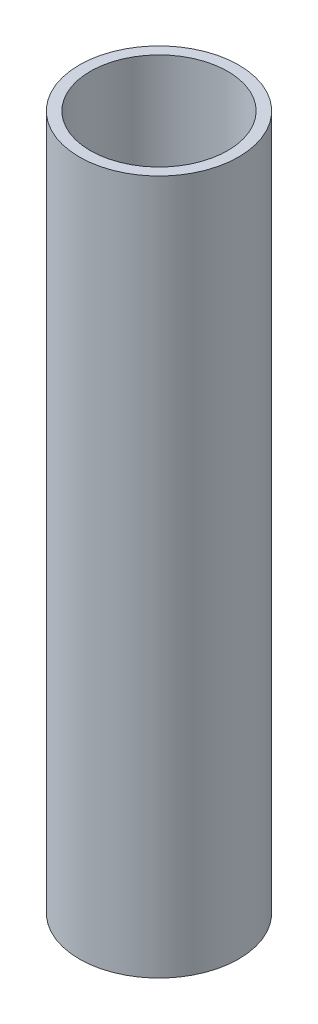
from build123d import *

# Parameters (mm, degrees)
SKETCH2_R           = 58.293
SKETCH2_R_2         = 50.2539
BOSS_EXTRUDE1_DEPTH = 508


with BuildPart() as part:
    # Sketch2 → Boss-Extrude1 (new body)
    with BuildSketch(Plane(origin=(0, 0, 0), x_dir=(1, 0, 0), z_dir=(0, 1, 0))):
        Circle(SKETCH2_R)
        Circle(SKETCH2_R_2, mode=Mode.SUBTRACT)
    extrude(amount=BOSS_EXTRUDE1_DEPTH)


solid = part.part
